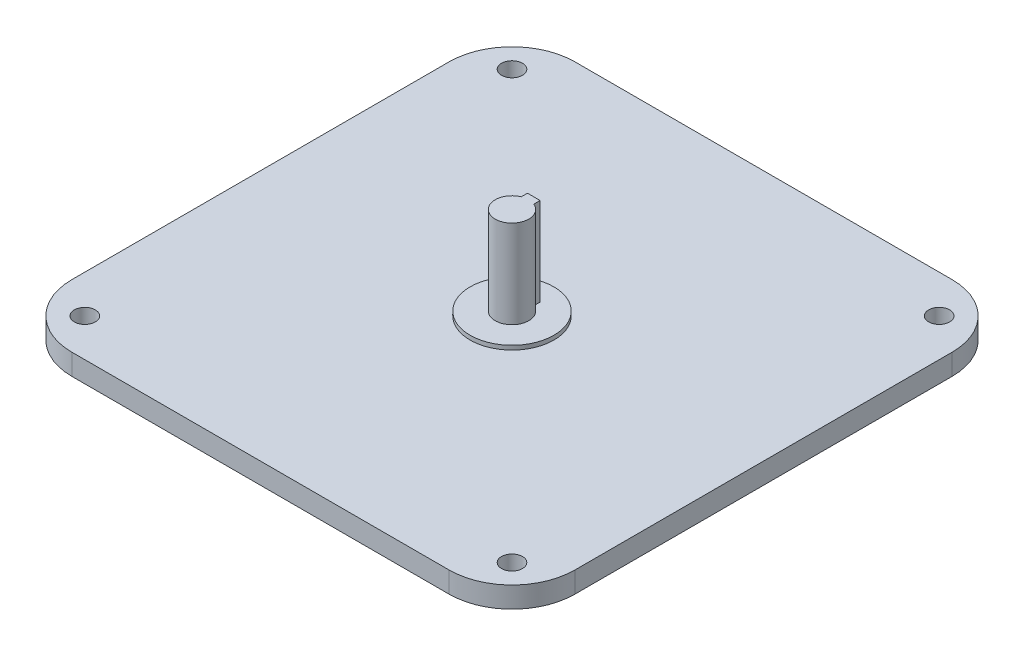
from build123d import *

# Parameters (mm, degrees)
ESBO_O1_W                = 120
ESBO_O1_H                = 120
ESBO_O1_R                = 2.5
RESSALTO_EXTRUS_O1_DEPTH = 2.5
FILETE1_R                = 15
RESSALTO_EXTRUS_O2_DEPTH = 22
ESBO_O3_R                = 10
RESSALTO_EXTRUS_O3_DEPTH = 1


with BuildPart() as part:
    # Esboço1 → Ressalto-extrusão1 (new, symmetric)
    with BuildSketch(Plane(origin=(0, 0, 0), x_dir=(1, 0, 0), z_dir=(0, 1, 0))):
        Rectangle(ESBO_O1_W, ESBO_O1_H)
        with Locations((-50.955395397, -50.955395397)):
            Circle(ESBO_O1_R, mode=Mode.SUBTRACT)
        with Locations((-50.955395397, 50.955395397)):
            Circle(ESBO_O1_R, mode=Mode.SUBTRACT)
        with Locations((50.955395397, 50.955395397)):
            Circle(ESBO_O1_R, mode=Mode.SUBTRACT)
        with Locations((50.955395397, -50.955395397)):
            Circle(ESBO_O1_R, mode=Mode.SUBTRACT)
    extrude(amount=RESSALTO_EXTRUS_O1_DEPTH, both=True)

    # Filete1
    filete1_edges = [part.edges().sort_by_distance(p)[0] for p in [
        (-60, 0, -60),
        (60, 0, -60),
        (60, 0, 60),
        (-60, 0, 60),
    ]]
    fillet(filete1_edges, radius=FILETE1_R)

    # Esboço2 → Ressalto-extrusão2 (add)
    with BuildSketch(Plane(origin=(0, 2.5, 0), x_dir=(1, 0, 0), z_dir=(0, 1, 0))):
        with BuildLine():
            Line((-1.5, 5.2), (1.5, 5.2))
            Line((1.5, 5.2), (1.5, 3.708099244))
            ThreePointArc((1.5, 3.708099244), (0, -4), (-1.5, 3.708099244))
            Line((-1.5, 3.708099244), (-1.5, 5.2))
        make_face()
    extrude(amount=RESSALTO_EXTRUS_O2_DEPTH)

    # Esboço3 → Ressalto-extrusão3 (add)
    with BuildSketch(Plane(origin=(0, 2.5, 0), x_dir=(1, 0, 0), z_dir=(0, 1, 0))):
        Circle(ESBO_O3_R)
    extrude(amount=RESSALTO_EXTRUS_O3_DEPTH)


solid = part.part
